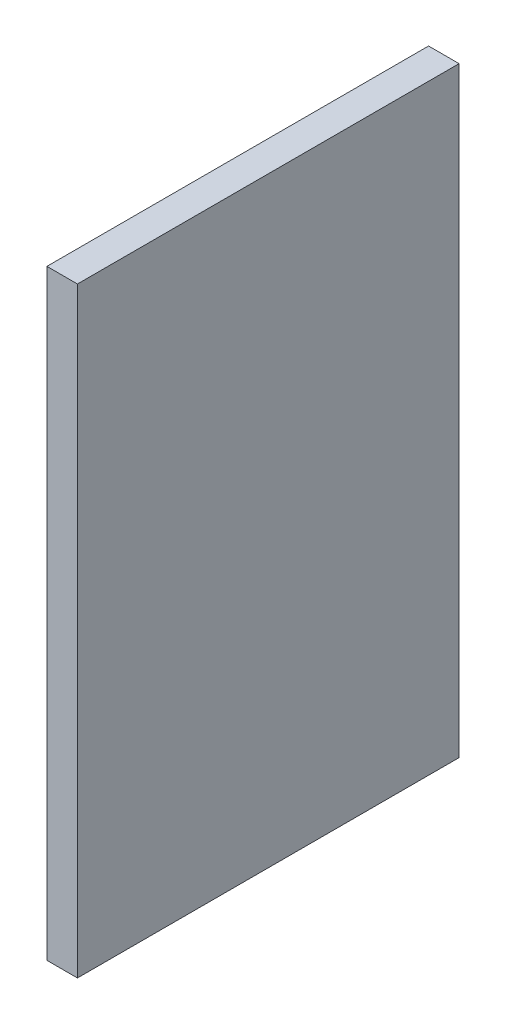
from build123d import *

# Parameters (mm, degrees)
SKETCH1_W           = 2.54
SKETCH1_H           = 31.75
BOSS_EXTRUDE1_DEPTH = 49.9999
SKETCH5_R           = 2.99974
SKETCH5_R_2         = 1.6002
BOSS_EXTRUDE3_DEPTH = 8.6106


with BuildPart() as part:
    # Sketch1 → Boss-Extrude1 (new body)
    with BuildSketch(Plane(origin=(0, 0, 0), x_dir=(1, 0, 0), z_dir=(0, 1, 0))):
        with Locations((1.27, 15.875)):
            Rectangle(SKETCH1_W, SKETCH1_H)
    extrude(amount=BOSS_EXTRUDE1_DEPTH)

    # Sketch5 → Boss-Extrude3 (add)
    # profile 1 of 2: a face of its own
    with BuildSketch(Plane(origin=(0, 0, 0), x_dir=(0, 0, -1), z_dir=(1, 0, 0))):
        with Locations((15.875, 15.00124)):
            Circle(SKETCH5_R)
        with Locations((15.875, 15.00124)):
            Circle(SKETCH5_R_2, mode=Mode.SUBTRACT)
    # profile 2 of 2: a face of its own
    with BuildSketch(Plane(origin=(0, 0, 0), x_dir=(0, 0, -1), z_dir=(1, 0, 0))):
        with Locations((15.875, 35.0012)):
            Circle(SKETCH5_R)
        with Locations((15.875, 35.0012)):
            Circle(SKETCH5_R_2, mode=Mode.SUBTRACT)
    extrude(amount=-BOSS_EXTRUDE3_DEPTH)


solid = part.part
